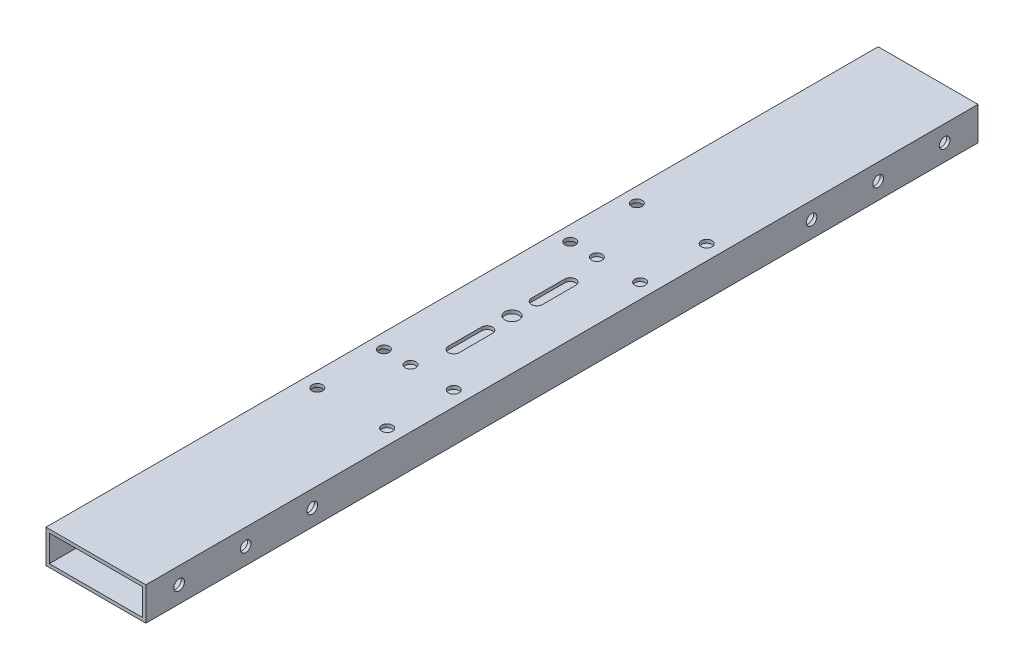
from build123d import *

# Parameters (mm, degrees)
SKETCH_1_W          = 30
SKETCH_1_H          = 10
SKETCH_1_W_2        = 27
SKETCH_1_H_2        = 7
EXTRUDE_1_DEPTH     = 250
SKETCH_2_R          = 1.6
CUT_EXTRUDE_1_DEPTH = 252.843205189
SKETCH_3_R          = 1.6
CUT_EXTRUDE_2_DEPTH = 251.64915719
SKETCH_4_R          = 2.15
CUT_EXTRUDE_3_DEPTH = 251.64915719
SKETCH_6_W          = 28
SKETCH_6_H          = 8
CUT_EXTRUDE_5_DEPTH = 330


with BuildPart() as part:
    # 草图1 → 凸台-拉伸1 (new body)
    with BuildSketch(Plane.XY):
        Rectangle(SKETCH_1_W, SKETCH_1_H)
        Rectangle(SKETCH_1_W_2, SKETCH_1_H_2, mode=Mode.SUBTRACT)
    extrude(amount=EXTRUDE_1_DEPTH)

    # 草图2 → 切除-拉伸1 (cut, through all)
    with BuildSketch(Plane(origin=(15, 0, 0), x_dir=(0, 0, -1), z_dir=(1, 0, 0))):
        with Locations((-240, 0)):
            Circle(SKETCH_2_R)
        with Locations((-220, 0)):
            Circle(SKETCH_2_R)
        with Locations((-200, 0)):
            Circle(SKETCH_2_R)
        with Locations((-50, 0)):
            Circle(SKETCH_2_R)
        with Locations((-30, 0)):
            Circle(SKETCH_2_R)
        with Locations((-10, 0)):
            Circle(SKETCH_2_R)
    extrude(amount=-CUT_EXTRUDE_1_DEPTH, mode=Mode.SUBTRACT)

    # 草图3 → 切除-拉伸2 (cut, through all)
    with BuildSketch(Plane(origin=(0, 5, 0), x_dir=(1, 0, 0), z_dir=(0, 1, 0))):
        with Locations((-2.5, -97)):
            Circle(SKETCH_3_R)
        with Locations((10.5, -97)):
            Circle(SKETCH_3_R)
        with Locations((-2.5, -153)):
            Circle(SKETCH_3_R)
        with Locations((10.5, -153)):
            Circle(SKETCH_3_R)
        with Locations((10.5, -173)):
            Circle(SKETCH_3_R)
        with Locations((10.5, -77)):
            Circle(SKETCH_3_R)
        with Locations((-10.5, -173)):
            Circle(SKETCH_3_R)
        with Locations((-10.5, -153)):
            Circle(SKETCH_3_R)
        with Locations((-10.5, -77)):
            Circle(SKETCH_3_R)
        with Locations((-10.5, -97)):
            Circle(SKETCH_3_R)
    extrude(amount=-CUT_EXTRUDE_2_DEPTH, mode=Mode.SUBTRACT)

    # 草图4 → 切除-拉伸3 (cut, through all)
    with BuildSketch(Plane(origin=(0, 5, 0), x_dir=(1, 0, 0), z_dir=(0, 1, 0))):
        with Locations((0, -125)):
            Circle(SKETCH_4_R)
        with BuildLine():
            Line((-1.65, -107.5), (-1.65, -117.5))
            ThreePointArc((-1.65, -117.5), (0, -119.15), (1.65, -117.5))
            Line((1.65, -117.5), (1.65, -107.5))
            ThreePointArc((1.65, -107.5), (0, -105.85), (-1.65, -107.5))
        make_face()
        with BuildLine():
            Line((1.65, -142.5), (1.65, -132.5))
            ThreePointArc((1.65, -132.5), (0, -130.85), (-1.65, -132.5))
            Line((-1.65, -132.5), (-1.65, -142.5))
            ThreePointArc((-1.65, -142.5), (0, -144.15), (1.65, -142.5))
        make_face()
    extrude(amount=-CUT_EXTRUDE_3_DEPTH, mode=Mode.SUBTRACT)

    # 草图6 → 切除-拉伸5 (cut)
    with BuildSketch(Plane(origin=(0, 0, 0), x_dir=(-1, 0, 0), z_dir=(0, 0, -1))):
        Rectangle(SKETCH_6_W, SKETCH_6_H)
    extrude(amount=-CUT_EXTRUDE_5_DEPTH, mode=Mode.SUBTRACT)


solid = part.part
